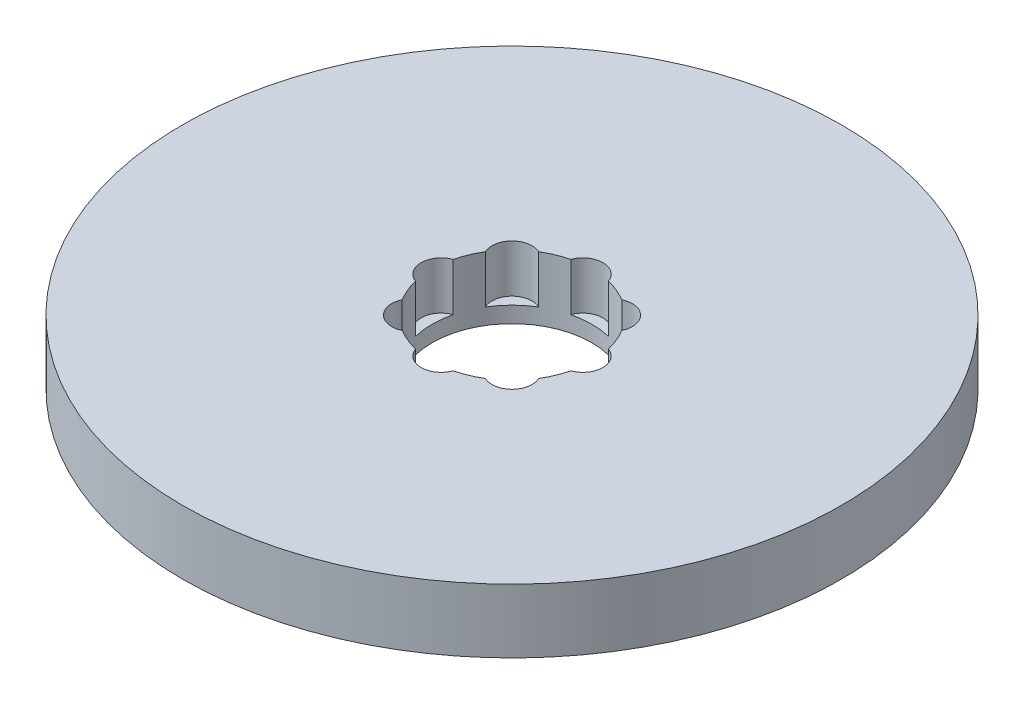
from build123d import *

# Parameters (mm, degrees)
SKETCH1_R           = 82.5
BOSS_EXTRUDE1_DEPTH = 16
SKETCH2_R           = 20
CUT_EXTRUDE1_DEPTH  = 118.764595698
SKETCH3_R           = 5.009100425
CUT_EXTRUDE2_DEPTH  = 11.977073373
CIRPATTERN1_COUNT   = 8


with BuildPart() as part:
    # Sketch1 → Boss-Extrude1 (new body)
    with BuildSketch(Plane(origin=(0, 0, 0), x_dir=(1, 0, 0), z_dir=(0, 1, 0))):
        Circle(SKETCH1_R)
    extrude(amount=BOSS_EXTRUDE1_DEPTH)

    # Sketch2 → Cut-Extrude1 (cut, through all)
    with BuildSketch(Plane(origin=(0, 0, 0), x_dir=(1, 0, 0), z_dir=(0, 1, 0))):
        Circle(SKETCH2_R)
    extrude(amount=CUT_EXTRUDE1_DEPTH, mode=Mode.SUBTRACT)

    # Sketch3 → Cut-Extrude2 (cut)
    with BuildSketch(Plane(origin=(0, 16, 0), x_dir=(1, 0, 0), z_dir=(0, 1, 0))):
        with Locations((-17.742379925, 0)):
            Circle(SKETCH3_R)
    cut_extrude2 = extrude(amount=-CUT_EXTRUDE2_DEPTH, mode=Mode.SUBTRACT)

    # CirPattern1: Cut-Extrude2 ×8 about axis
    cirpattern1_axis = Axis((0, 0, 0), (0, 1, 0))
    for i in range(1, CIRPATTERN1_COUNT):
        add(cut_extrude2.rotate(cirpattern1_axis, i * 360 / CIRPATTERN1_COUNT), mode=Mode.SUBTRACT)


solid = part.part
